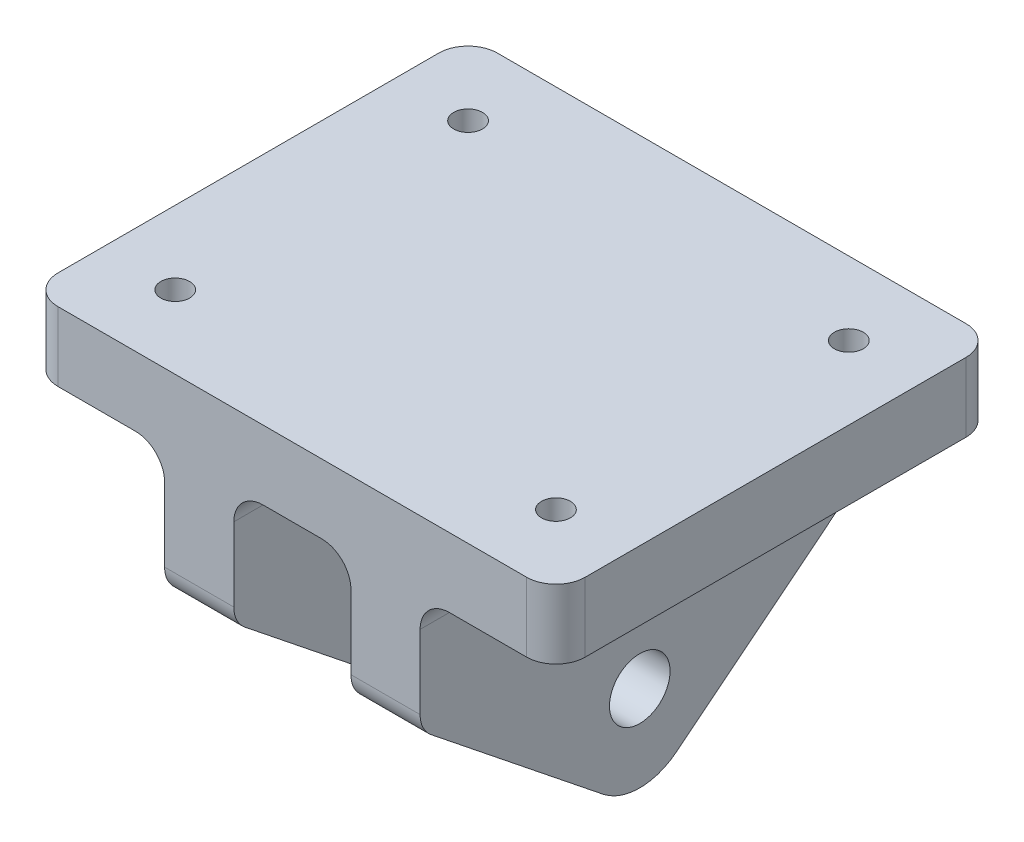
from build123d import *
from OCP.BRepFilletAPI import BRepFilletAPI_MakeFillet

# Parameters (mm, degrees)
SKETCH1_R           = 2.627
BOSS_EXTRUDE1_DEPTH = 6
BOSS_EXTRUDE2_START = -5.08
SKETCH1_3_W         = 38.1
SKETCH1_3_H         = 5.999999938
BOSS_EXTRUDE2_DEPTH = 22.86
SKETCH3_R           = 1.25
CUT_EXTRUDE1_DEPTH  = 44.260167546
FILLET1_R1          = 2.54
FILLET1_R2          = 5.08
SKETCH4_R           = 4.2145
SKETCH4_R_2         = 2.627
BOSS_EXTRUDE3_DEPTH = 2.54
BOSS_EXTRUDE4_START = 7.62
SKETCH4_2_R         = 4.2145
SKETCH4_2_R_2       = 2.627
BOSS_EXTRUDE4_DEPTH = 2.54
CHAMFER2_SIZE       = 2.54


with BuildPart() as part:
    # Sketch1 → Boss-Extrude1 (new body)
    with BuildSketch(Plane(origin=(5.08, 0, 0), x_dir=(0, 0, -1), z_dir=(1, 0, 0))):
        Polygon((-19.05, 0), (-19.05, -10.16), (0, -25.4), (19.05, -10.16), (19.05, 0), align=None)
        with Locations((0, -16.51)):
            Circle(SKETCH1_R, mode=Mode.SUBTRACT)
    boss_extrude1 = extrude(amount=BOSS_EXTRUDE1_DEPTH)

    # Sketch1<3> → Boss-Extrude2 (add)
    with BuildSketch(Plane(origin=(5.08, 0, 0), x_dir=(0, 0, -1), z_dir=(1, 0, 0)).offset(BOSS_EXTRUDE2_START)):
        with Locations((0, 2.999999969)):
            Rectangle(SKETCH1_3_W, SKETCH1_3_H)
    boss_extrude2 = extrude(amount=BOSS_EXTRUDE2_DEPTH)

    # Sketch3 → Cut-Extrude1 (cut, through all)
    with BuildSketch(Plane(origin=(0, 5.999999938, 0), x_dir=(1, 0, 0), z_dir=(0, 1, 0))):
        with Locations(Location((16.51, 12.7, 0), (0, 0, 270))):
            Circle(SKETCH3_R)
        with Locations(Location((16.51, -12.7, 0), (0, 0, 90))):
            Circle(SKETCH3_R)
    cut_extrude1 = extrude(amount=-CUT_EXTRUDE1_DEPTH, mode=Mode.SUBTRACT)

    # Mirror2: Boss-Extrude2, Cut-Extrude1 across plane
    add(boss_extrude2.mirror(Plane(origin=(0, 0, 0), x_dir=(0, 0, 1), z_dir=(1, 0, 0))))
    add(cut_extrude1.mirror(Plane(origin=(0, 0, 0), x_dir=(0, 0, 1), z_dir=(1, 0, 0))), mode=Mode.SUBTRACT)

    # Mirror3: Boss-Extrude1 across plane
    add(boss_extrude1.mirror(Plane(origin=(0, 0, 0), x_dir=(0, 0, 1), z_dir=(1, 0, 0))))

    # Fillet1: one fillet with a radius per group of edges: ONE call of the kernel's fillet builder (fillet() takes one radius for all edges)
    fillet1_edges_1 = [part.edges().sort_by_distance(p)[0] for p in [
        (8.08, -10.16, 19.05),
        (8.08, -10.16, -19.05),
        (11.08, 0, 0),
        (22.86, 2.999999969, 19.05),
        (22.86, 2.999999969, -19.05),
        (-22.86, 2.999999969, -19.05),
        (-22.86, 2.999999969, 19.05),
        (-8.08, -10.16, -19.05),
        (-8.08, -10.16, 19.05),
        (-5.08, 0, 0),
        (-11.08, 0, 0),
        (5.08, 0, 0),
    ]]
    fillet1_edges_2 = [part.edges().sort_by_distance(p)[0] for p in [
        (8.08, -25.4, 0),
        (-8.08, -25.4, 0),
    ]]
    fillet1 = BRepFilletAPI_MakeFillet(part.part.solid().wrapped)
    for e in fillet1_edges_1:
        fillet1.Add(FILLET1_R1, e.wrapped)
    for e in fillet1_edges_2:
        fillet1.Add(FILLET1_R2, e.wrapped)
    add(Compound.cast(fillet1.Shape()), mode=Mode.REPLACE)

    # Sketch4 → Boss-Extrude3 (add)
    with BuildSketch(Plane.ZY.offset(-5.08)):
        with Locations(Location((0, -16.51, 0), (0, 0, 180))):
            Circle(SKETCH4_R)
        with Locations((0, -16.51)):
            Circle(SKETCH4_R_2, mode=Mode.SUBTRACT)
    extrude(amount=BOSS_EXTRUDE3_DEPTH)

    # Sketch4<2> → Boss-Extrude4 (add)
    with BuildSketch(Plane.ZY.offset(-5.08).offset(BOSS_EXTRUDE4_START)):
        with Locations(Location((0, -16.51, 0), (0, 0, 180))):
            Circle(SKETCH4_2_R)
        with Locations((0, -16.51)):
            Circle(SKETCH4_2_R_2, mode=Mode.SUBTRACT)
    extrude(amount=BOSS_EXTRUDE4_DEPTH)

    # Chamfer2
    chamfer2_edges = [part.edges().sort_by_distance(p)[0] for p in [
        (5.08, -16.51, 4.2145),
        (-5.08, -16.51, 4.2145),
    ]]
    chamfer(chamfer2_edges, length=CHAMFER2_SIZE - 0.0001)  # a hair under: the kernel refuses the full size


solid = part.part
